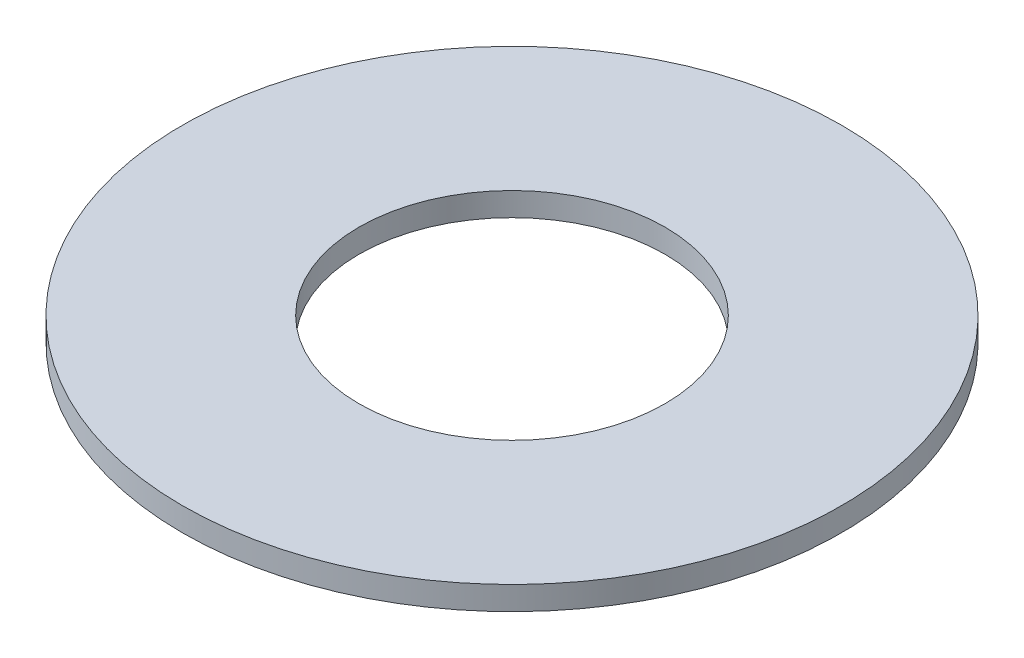
from build123d import *

# Parameters (mm, degrees)
SKETCH1_R           = 70
BOSS_EXTRUDE1_DEPTH = 5
SKETCH2_R           = 32.5
CUT_EXTRUDE1_DEPTH  = 100.121138008


with BuildPart() as part:
    # Sketch1 → Boss-Extrude1 (new body)
    with BuildSketch(Plane(origin=(0, 0, 0), x_dir=(1, 0, 0), z_dir=(0, 1, 0))):
        Circle(SKETCH1_R)
    extrude(amount=BOSS_EXTRUDE1_DEPTH)

    # Sketch2 → Cut-Extrude1 (cut, through all)
    with BuildSketch(Plane(origin=(0, 0, 0), x_dir=(1, 0, 0), z_dir=(0, 1, 0))):
        Circle(SKETCH2_R)
    extrude(amount=CUT_EXTRUDE1_DEPTH, mode=Mode.SUBTRACT)


solid = part.part
